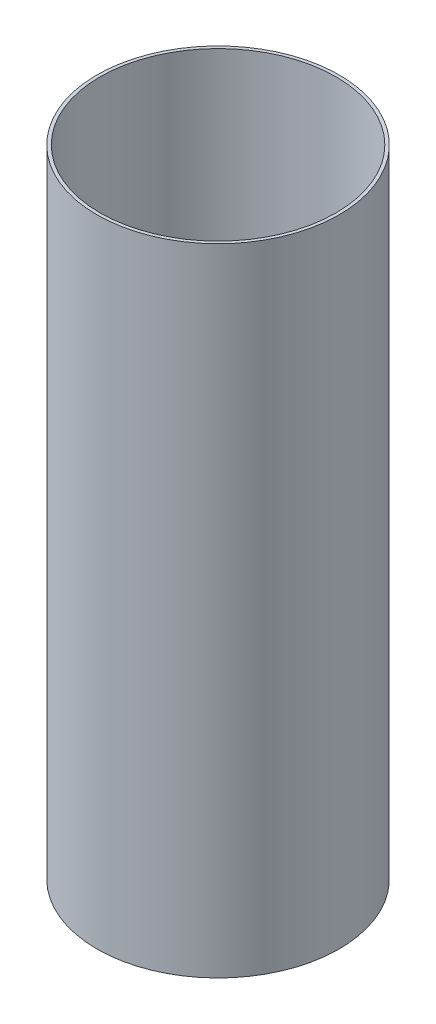
from build123d import *

# Parameters (mm, degrees)
SKETCH1_R           = 76.2
SKETCH1_R_2         = 74.2
BOSS_EXTRUDE1_DEPTH = 400


with BuildPart() as part:
    # Sketch1 → Boss-Extrude1 (new body)
    with BuildSketch(Plane(origin=(0, 0, 0), x_dir=(1, 0, 0), z_dir=(0, 1, 0))):
        Circle(SKETCH1_R)
        Circle(SKETCH1_R_2, mode=Mode.SUBTRACT)
    extrude(amount=BOSS_EXTRUDE1_DEPTH)


solid = part.part
